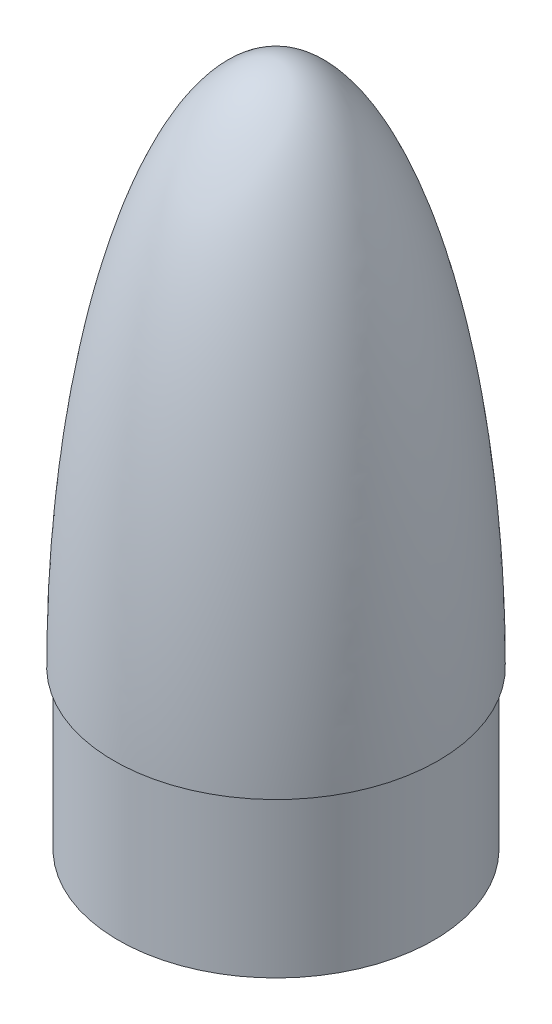
from build123d import *

# Parameters (mm, degrees)
SKETCH2_R           = 76.2
BOSS_EXTRUDE1_DEPTH = 76.2
SKETCH4_R           = 17.78
CUT_EXTRUDE1_DEPTH  = 96.52
CUT_EXTRUDE2_START  = 106.68
SKETCH5_R           = 8.255
CUT_EXTRUDE2_DEPTH  = 119.38
CUT_EXTRUDE3_START  = -25.4
SKETCH19_R          = 15.24
CUT_EXTRUDE3_DEPTH  = 101.6
SKETCH21_R          = 2.54
CUT_EXTRUDE4_DEPTH  = 6.35
SKETCH22_R          = 3
CUT_EXTRUDE5_DEPTH  = 12.7


with BuildPart() as part:
    # Sketch1 → Revolve1 (revolve)
    with BuildSketch(Plane.XY):
        with BuildLine():
            Line((78.359, 0), (0, 0))
            Line((0, 0), (0, 254))
            add(Edge.make_bspline(
                [(78.359, 0), (78.359, 0.547287489), (78.357845602, 1.649563618), (78.352650776, 3.586349875), (78.338796346, 5.988934596), (78.318010672, 8.352211569), (78.29028895, 10.745600888), (78.246958697, 13.731411826), (78.181061307, 17.311703382), (78.08386626, 21.490442467), (77.944822085, 26.264117007), (77.777683186, 31.037557631), (77.58229134, 35.809557456), (77.358460439, 40.580511863), (77.042853487, 46.542286246), (76.679080298, 52.501436144), (76.266448568, 58.457359127), (75.804102806, 64.409607399), (75.404015228, 69.168949637), (74.865626928, 75.114798701), (74.157385744, 82.243973993), (73.238266918, 90.551730955), (72.055740597, 100.030771811), (70.735528943, 109.491671534), (69.270929118, 118.931305028), (67.249996919, 130.699881306), (64.501732948, 144.763840427), (61.308555538, 158.735984092), (57.591049496, 172.577213574), (53.383025938, 186.275905479), (49.238746312, 198.044837449), (44.48323743, 209.587335711), (38.942884235, 220.71924179), (34.256173135, 228.693595393), (29.818710248, 235.095423042), (25.624249732, 240.182852143), (21.978892835, 243.926180276), (18.570150197, 246.859542723), (15.474349081, 249.076247661), (12.563405711, 250.785701438), (9.772327363, 252.083533871), (7.063069709, 253.028642362), (4.275373805, 253.686778481), (2.188006886, 253.939891173), (0.767171586, 253.999916555), (0, 254)],
                knots=[0.083290168, 0.083290168, 0.083290168, 0.083290168, 0.083290168, 0.091119674, 0.09894918, 0.106778686, 0.114608192, 0.122437698, 0.130267203, 0.145926215, 0.161585227, 0.177244239, 0.192903251, 0.208562263, 0.224221275, 0.239880287, 0.27119831, 0.286857322, 0.302516334, 0.318175346, 0.333834359, 0.365152383, 0.396470407, 0.42778843, 0.459106453, 0.490424474, 0.521742495, 0.584378539, 0.647014581, 0.678332609, 0.709650637, 0.772286631, 0.810589211, 0.841907031, 0.872607503, 0.893486158, 0.91262845, 0.928287274, 0.941044948, 0.952387223, 0.962498308, 0.97249612, 0.981348672, 0.989949856, 1, 1, 1, 1, 1], degree=4))
        make_face()
    revolve(axis=Axis((0, 254, 0), (0, -1, 0)))

    # Sketch2 → Boss-Extrude1 (add)
    with BuildSketch(Plane.XZ):
        Circle(SKETCH2_R)
    extrude(amount=BOSS_EXTRUDE1_DEPTH)

    # Sketch4 → Cut-Extrude1 (cut)
    with BuildSketch(Plane(origin=(0, 0, 0), x_dir=(1, 0, 0), z_dir=(0, 1, 0))):
        with Locations((48.26, 0)):
            Circle(SKETCH4_R)
        with Locations((0, -48.26)):
            Circle(SKETCH4_R)
        with Locations((-48.26, 0)):
            Circle(SKETCH4_R)
        with Locations((0, 48.26)):
            Circle(SKETCH4_R)
    extrude(amount=CUT_EXTRUDE1_DEPTH, mode=Mode.SUBTRACT)

    # Sketch5 → Cut-Extrude2 (cut)
    with BuildSketch(Plane(origin=(0, 0, 0), x_dir=(1, 0, 0), z_dir=(0, 1, 0)).offset(CUT_EXTRUDE2_START)):
        with Locations((20.32, 0)):
            Circle(SKETCH5_R)
        with Locations((10.16, -17.597636205)):
            Circle(SKETCH5_R)
        with Locations((-10.16, -17.597636205)):
            Circle(SKETCH5_R)
        with Locations((-20.32, 0)):
            Circle(SKETCH5_R)
        with Locations((-10.16, 17.597636205)):
            Circle(SKETCH5_R)
        with Locations((10.16, 17.597636205)):
            Circle(SKETCH5_R)
    extrude(amount=CUT_EXTRUDE2_DEPTH, mode=Mode.SUBTRACT)

    # Sketch6 → Cut-Revolve2 (revolve, cut)
    with BuildSketch(Plane.XY):
        Polygon((-30.48, 96.52), (-48.26, 117.709378876), (-48.26, 96.52), align=None)
    revolve(axis=Axis((-48.26, 96.52, 0), (0, -1, 0)), mode=Mode.SUBTRACT)

    # Sketch8 → Cut-Revolve4 (revolve, cut)
    with BuildSketch(Plane.XY.offset(48.26)):
        Polygon((0, 96.52), (17.78, 96.52), (0, 117.709378876), align=None)
    revolve(axis=Axis((0, 96.52, 48.26), (0, -1, 0)), mode=Mode.SUBTRACT)

    # Sketch9 → Cut-Revolve5 (revolve, cut)
    with BuildSketch(Plane.XY):
        Polygon((48.26, 96.52), (66.04, 96.52), (48.26, 117.709378876), align=None)
    revolve(axis=Axis((48.26, 96.52, 0), (0, -1, 0)), mode=Mode.SUBTRACT)

    # Sketch11 → Cut-Revolve6 (revolve, cut)
    with BuildSketch(Plane.XY.offset(-48.26)):
        Polygon((0, 96.52), (17.78, 96.52), (0, 117.709378876), align=None)
    revolve(axis=Axis((0, 96.52, -48.26), (0, -1, 0)), mode=Mode.SUBTRACT)

    # Sketch12 → Cut-Revolve7 (revolve, cut)
    with BuildSketch(Plane.XY):
        Polygon((-20.32, 226.06), (-12.065, 226.06), (-20.32, 235.897925907), align=None)
    revolve(axis=Axis((-20.32, 226.06, 0), (0, -1, 0)), mode=Mode.SUBTRACT)

    # Sketch14 → Cut-Revolve8 (revolve, cut)
    with BuildSketch(Plane.XY):
        Polygon((20.32, 226.06), (28.575, 226.06), (20.32, 235.897925907), align=None)
    revolve(axis=Axis((20.32, 235.897925907, 0), (0, -1, 0)), mode=Mode.SUBTRACT)

    # Sketch15 → Cut-Revolve9 (revolve, cut)
    with BuildSketch(Plane.XY.offset(17.597636205)):
        Polygon((-10.16, 226.06), (-1.905, 226.06), (-10.16, 235.897925907), align=None)
    revolve(axis=Axis((-10.16, 226.06, 17.597636205), (0, -1, 0)), mode=Mode.SUBTRACT)

    # Sketch16 → Cut-Revolve10 (revolve, cut)
    with BuildSketch(Plane.XY.offset(17.597636205)):
        Polygon((10.16, 226.06), (18.415, 226.06), (10.16, 235.897925907), align=None)
    revolve(axis=Axis((10.16, 235.897925907, 17.597636205), (0, -1, 0)), mode=Mode.SUBTRACT)

    # Sketch17 → Cut-Revolve11 (revolve, cut)
    with BuildSketch(Plane.XY.offset(-17.597636205)):
        Polygon((10.16, 226.06), (18.415, 226.06), (10.16, 235.897925907), align=None)
    revolve(axis=Axis((10.16, 235.897925907, -17.597636205), (0, -1, 0)), mode=Mode.SUBTRACT)

    # Sketch18 → Cut-Revolve12 (revolve, cut)
    with BuildSketch(Plane.XY.offset(-17.597636205)):
        Polygon((-10.16, 226.06), (-1.905, 226.06), (-10.16, 235.897925907), align=None)
    revolve(axis=Axis((-10.16, 235.897925907, -17.597636205), (0, -1, 0)), mode=Mode.SUBTRACT)

    # Sketch19 → Cut-Extrude3 (cut)
    with BuildSketch(Plane(origin=(0, 0, 0), x_dir=(1, 0, 0), z_dir=(0, 1, 0)).offset(CUT_EXTRUDE3_START)):
        Circle(SKETCH19_R)
    extrude(amount=CUT_EXTRUDE3_DEPTH, mode=Mode.SUBTRACT)

    # Sketch20 → Cut-Revolve13 (revolve, cut)
    with BuildSketch(Plane.XY):
        Polygon((0, 76.2), (15.24, 76.2), (0, 94.362324751), align=None)
    revolve(axis=Axis((0, 270.51, 0), (0, -1, 0)), mode=Mode.SUBTRACT)

    # Sketch21 → Cut-Extrude4 (cut)
    with BuildSketch(Plane.XZ.offset(76.2)):
        with Locations((-44.16298, 0)):
            Circle(SKETCH21_R)
        with Locations((0, 37.81298)):
            Circle(SKETCH21_R)
        with Locations((31.46298, 0)):
            Circle(SKETCH21_R)
        with Locations((0, -37.81298)):
            Circle(SKETCH21_R)
    extrude(amount=-CUT_EXTRUDE4_DEPTH, mode=Mode.SUBTRACT)

    # Sketch22 → Cut-Extrude5 (cut)
    with BuildSketch(Plane.XZ.offset(76.2)):
        with Locations((-32.492203438, -39.049925937)):
            Circle(SKETCH22_R)
        with Locations((-39.049925937, 32.492203438)):
            Circle(SKETCH22_R)
        with Locations((32.492203438, 39.049925937)):
            Circle(SKETCH22_R)
        with Locations((39.049925937, -32.492203438)):
            Circle(SKETCH22_R)
    extrude(amount=-CUT_EXTRUDE5_DEPTH, mode=Mode.SUBTRACT)

    # Sketch3 → Cut-Revolve1 (revolve, cut)
    with BuildSketch(Plane.XY):
        with BuildLine():
            Line((0, 0), (50.695639171, 0))
            ThreePointArc((50.695639171, 0), (37.521185782, 66.292890616), (0, 122.510985441))
            Line((0, 122.510985441), (0, 0))
        make_face()
    revolve(axis=Axis((0, 270.51, 0), (0, -1, 0)), mode=Mode.SUBTRACT)


solid = part.part
